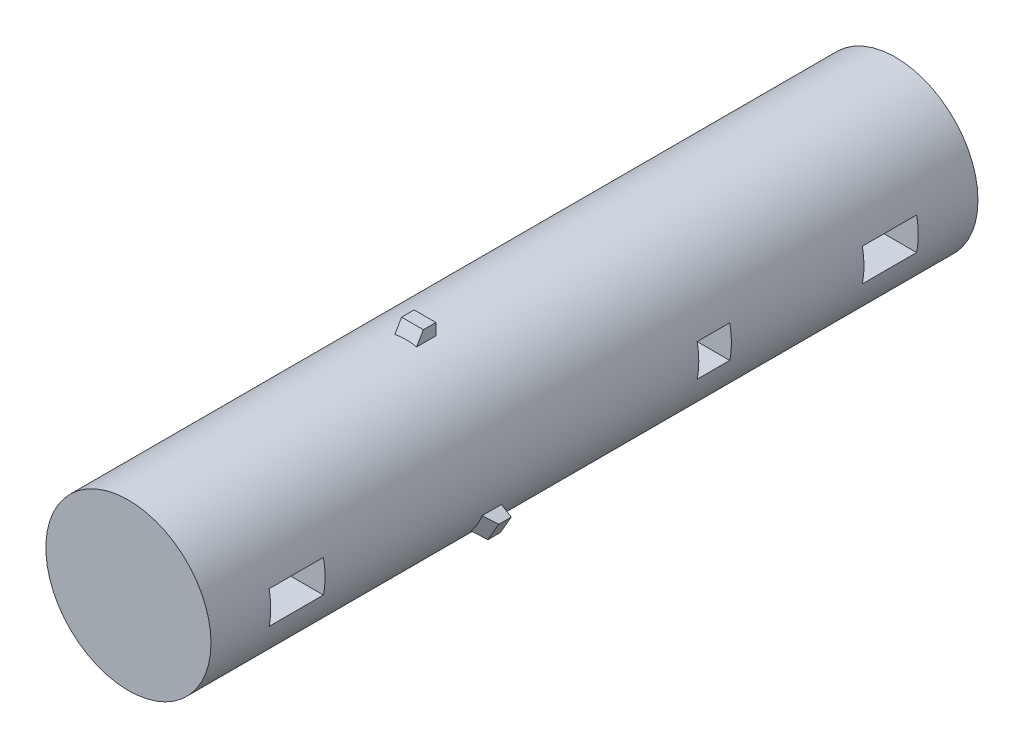
from build123d import *

# Parameters (mm, degrees)
SKETCH1_R               = 3.8
BOSS_EXTRUDE1_DEPTH     = 35.3
SKETCH3_W               = 2.5
SKETCH3_H               = 1.5
CUT_EXTRUDE2_DEPTH      = 36.706722056
CUT_EXTRUDE3_DEPTH      = 36.706722056
CUT_EXTRUDE3_DEPTH_BACK = 36.706722056
SKETCH6_W               = 1.5
SKETCH6_H               = 1.5
BOSS_EXTRUDE2_DEPTH     = 0.5
CIRPATTERN1_COUNT       = 3


with BuildPart() as part:
    # Sketch1 → Boss-Extrude1 (new body)
    with BuildSketch(Plane.XY):
        Circle(SKETCH1_R)
    extrude(amount=BOSS_EXTRUDE1_DEPTH)

    # Sketch3 → Cut-Extrude2 (cut, symmetric)
    with BuildSketch(Plane(origin=(0, 0, 0), x_dir=(0, 0, -1), z_dir=(1, 0, 0))):
        with Locations((-31.3, 0)):
            Rectangle(SKETCH3_W, SKETCH3_H)
    cut_extrude2 = extrude(amount=CUT_EXTRUDE2_DEPTH, both=True, mode=Mode.SUBTRACT)

    # Mirror1: Cut-Extrude2 across plane
    add(cut_extrude2.mirror(Plane.XY.offset(17.65)), mode=Mode.SUBTRACT)

    # Sketch6 → Cut-Extrude3 (cut, two sides: drawn at the far end of the back side and taken through both)
    with BuildSketch(Plane(origin=(0, 0, 0), x_dir=(0, 0, -1), z_dir=(1, 0, 0)).offset(-CUT_EXTRUDE3_DEPTH_BACK)):
        with Locations((-12.1, 0)):
            Rectangle(SKETCH6_W, SKETCH6_H)
    extrude(amount=CUT_EXTRUDE3_DEPTH + CUT_EXTRUDE3_DEPTH_BACK, mode=Mode.SUBTRACT)

    # Sketch7 → Boss-Extrude2 (add, symmetric)
    with BuildSketch(Plane(origin=(0, 0, 0), x_dir=(0, 0, -1), z_dir=(1, 0, 0))):
        Polygon((-22.227350269, 4.3), (-22.804700538, 3.3), (-21.65, 3.3), (-21.65, 4.3), align=None)
    boss_extrude2 = extrude(amount=BOSS_EXTRUDE2_DEPTH, both=True)

    # CirPattern1: Boss-Extrude2 ×3 about axis
    cirpattern1_axis = Axis((0, 0, 0), (0, 0, 1))
    for i in range(1, CIRPATTERN1_COUNT):
        add(boss_extrude2.rotate(cirpattern1_axis, i * 360 / CIRPATTERN1_COUNT))


solid = part.part
